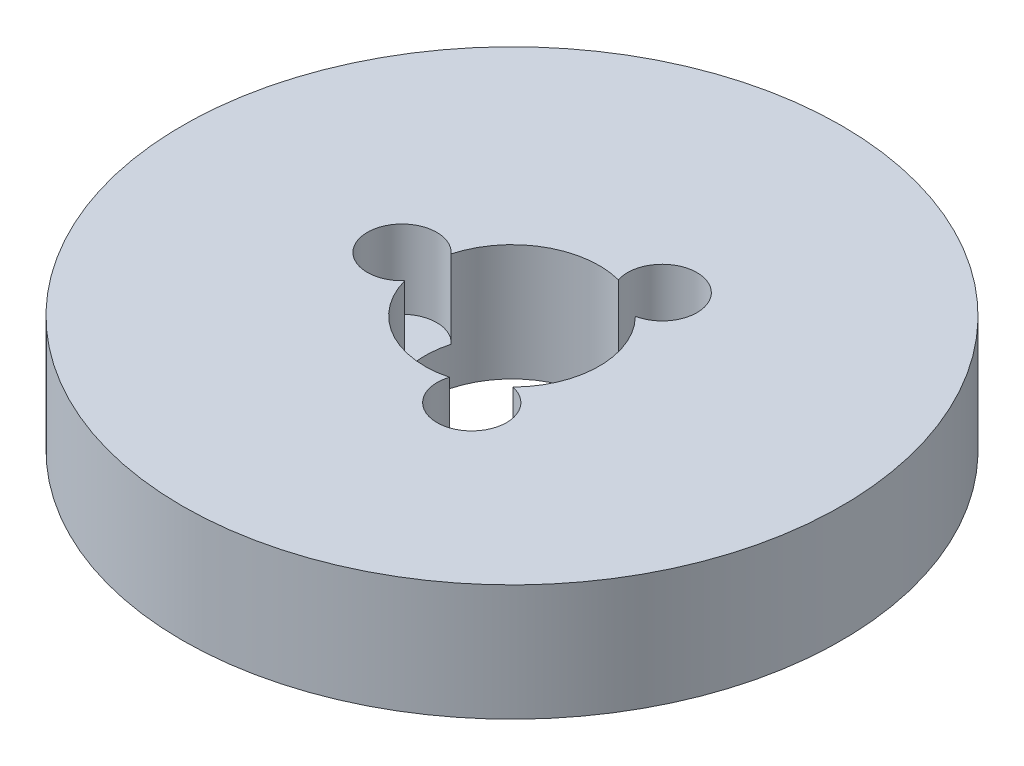
from build123d import *

# Parameters (mm, degrees)
SKETCH1_R           = 85
BOSS_EXTRUDE1_DEPTH = 30
SKETCH2_R           = 22.5
CUT_EXTRUDE1_DEPTH  = 124.895116934
SKETCH3_R           = 8.963701389
CUT_EXTRUDE2_DEPTH  = 20.1734998
CIRPATTERN1_COUNT   = 3


with BuildPart() as part:
    # Sketch1 → Boss-Extrude1 (new body)
    with BuildSketch(Plane(origin=(0, 0, 0), x_dir=(1, 0, 0), z_dir=(0, 1, 0))):
        Circle(SKETCH1_R)
    extrude(amount=BOSS_EXTRUDE1_DEPTH)

    # Sketch2 → Cut-Extrude1 (cut, through all)
    with BuildSketch(Plane(origin=(0, 0, 0), x_dir=(1, 0, 0), z_dir=(0, 1, 0))):
        Circle(SKETCH2_R)
    extrude(amount=CUT_EXTRUDE1_DEPTH, mode=Mode.SUBTRACT)

    # Sketch3 → Cut-Extrude2 (cut)
    with BuildSketch(Plane(origin=(0, 30, 0), x_dir=(1, 0, 0), z_dir=(0, 1, 0))):
        with Locations((-28.362498292, 0)):
            Circle(SKETCH3_R)
    cut_extrude2 = extrude(amount=-CUT_EXTRUDE2_DEPTH, mode=Mode.SUBTRACT)

    # CirPattern1: Cut-Extrude2 ×3 about axis
    cirpattern1_axis = Axis((0, 0, 0), (0, 1, 0))
    for i in range(1, CIRPATTERN1_COUNT):
        add(cut_extrude2.rotate(cirpattern1_axis, i * 360 / CIRPATTERN1_COUNT), mode=Mode.SUBTRACT)


solid = part.part
